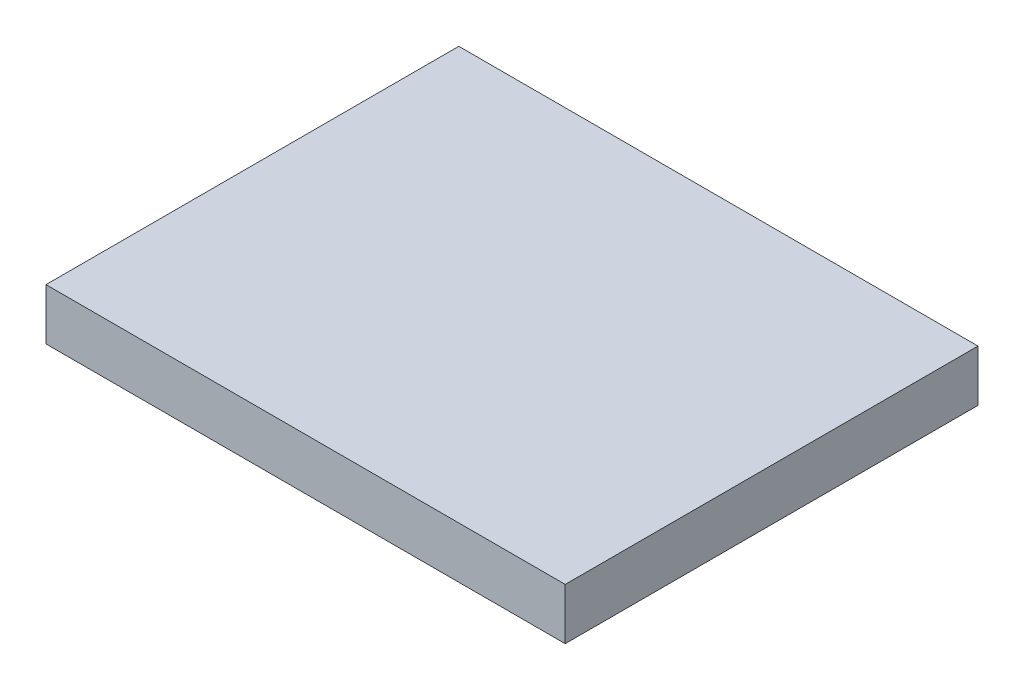
from build123d import *

# Parameters (mm, degrees)
SKETCH1_W           = 283
SKETCH1_H           = 225
BOSS_EXTRUDE1_DEPTH = 28
SKETCH2_R           = 10
BOSS_EXTRUDE2_DEPTH = 6.5


with BuildPart() as part:
    # Sketch1 → Boss-Extrude1 (new body)
    with BuildSketch(Plane(origin=(0, 0, 0), x_dir=(1, 0, 0), z_dir=(0, 1, 0))):
        with Locations((141.5, 112.5)):
            Rectangle(SKETCH1_W, SKETCH1_H)
    extrude(amount=BOSS_EXTRUDE1_DEPTH)

    # Sketch2 → Boss-Extrude2 (add)
    with BuildSketch(Plane.XZ):
        with Locations((25, -42.5)):
            Circle(SKETCH2_R)
        with Locations((25, -200)):
            Circle(SKETCH2_R)
        with Locations((258, -200)):
            Circle(SKETCH2_R)
        with Locations((258, -25)):
            Circle(SKETCH2_R)
    extrude(amount=BOSS_EXTRUDE2_DEPTH)


solid = part.part
